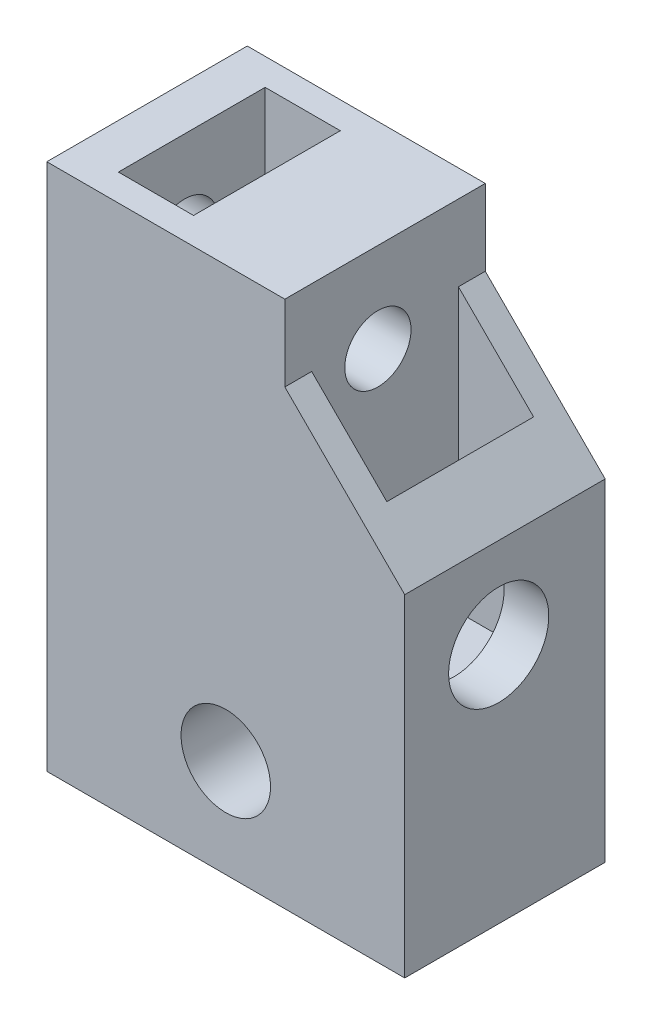
from build123d import *

# Parameters (mm, degrees)
SKETCH6_W           = 20
SKETCH6_H           = 11.2
BOSS_EXTRUDE2_DEPTH = 29.5
SKETCH7_R           = 2.5
CUT_EXTRUDE4_DEPTH  = 38.358934674
SKETCH8_R           = 2.8
CUT_EXTRUDE5_DEPTH  = 38.358934674
SKETCH9_W           = 4.2
SKETCH9_H           = 8.2
CUT_EXTRUDE6_DEPTH  = 20
SKETCH11_R          = 1.85
CUT_EXTRUDE8_DEPTH  = 38.358934674
SKETCH12_W          = 11.2
SKETCH12_H          = 11
CUT_EXTRUDE9_DEPTH  = 6.7
CHAMFER1_SIZE       = 6.75


with BuildPart() as part:
    # Sketch6 → Boss-Extrude2 (new body)
    with BuildSketch(Plane(origin=(0, 0, 0), x_dir=(1, 0, 0), z_dir=(0, 1, 0))):
        with Locations((10, 5.6)):
            Rectangle(SKETCH6_W, SKETCH6_H)
    extrude(amount=BOSS_EXTRUDE2_DEPTH)

    # Sketch7 → Cut-Extrude4 (cut, through all)
    with BuildSketch(Plane.XY):
        with Locations((10, 5.5)):
            Circle(SKETCH7_R)
    extrude(amount=-CUT_EXTRUDE4_DEPTH, mode=Mode.SUBTRACT)

    # Sketch8 → Cut-Extrude5 (cut, through all)
    with BuildSketch(Plane.ZY):
        with Locations((-5.25, 13.5)):
            Circle(SKETCH8_R)
    extrude(amount=-CUT_EXTRUDE5_DEPTH, mode=Mode.SUBTRACT)

    # Sketch9 → Cut-Extrude6 (cut)
    with BuildSketch(Plane(origin=(0, 29.5, 0), x_dir=(1, 0, 0), z_dir=(0, 1, 0))):
        with Locations((4.6, 5.6)):
            Rectangle(SKETCH9_W, SKETCH9_H)
        with Locations((15.4, 5.6)):
            Rectangle(SKETCH9_W, SKETCH9_H)
    extrude(amount=-CUT_EXTRUDE6_DEPTH, mode=Mode.SUBTRACT)

    # Sketch11 → Cut-Extrude8 (cut, through all)
    with BuildSketch(Plane(origin=(20, 0, 0), x_dir=(0, 0, -1), z_dir=(1, 0, 0))):
        with Locations((5.2, 24.5)):
            Circle(SKETCH11_R)
    extrude(amount=-CUT_EXTRUDE8_DEPTH, mode=Mode.SUBTRACT)

    # Sketch12 → Cut-Extrude9 (cut)
    with BuildSketch(Plane(origin=(20, 0, 0), x_dir=(0, 0, -1), z_dir=(1, 0, 0))):
        with Locations((5.6, 24)):
            Rectangle(SKETCH12_W, SKETCH12_H)
    extrude(amount=-CUT_EXTRUDE9_DEPTH, mode=Mode.SUBTRACT)

    # Chamfer1
    # the kernel refuses this chamfer: 6.75 mm, written as the material it adds along each edge
    with BuildSketch(Plane(origin=(13.3, 18.5, -11.2), x_dir=(-0.027495876610586268, 0.9996219169112968, 0), z_dir=(0, 0, 1))) as chamfer1_piece_1_section:
        Polygon((CHAMFER1_SIZE * 0.999621916911, -CHAMFER1_SIZE * 0.0274958766106), (-CHAMFER1_SIZE * 0.0274958766106, -CHAMFER1_SIZE * 0.999621916911), (0, 0), align=None)
    chamfer1_piece_1 = extrude(amount=1.5, mode=Mode.PRIVATE)
    chamfer1_piece_1 = split(chamfer1_piece_1, bisect_by=Plane(origin=(17.5, 21.005794574, -10.45), z_dir=(-1, 0, 0)), keep=Keep.TOP, mode=Mode.PRIVATE)
    add(chamfer1_piece_1)
    with BuildSketch(Plane(origin=(13.3, 18.5, -11.2), x_dir=(-0.027495876610586268, 0.9996219169112968, 0), z_dir=(0, 0, 1))) as chamfer1_piece_2_section:
        Polygon((CHAMFER1_SIZE * 0.999621916911, -CHAMFER1_SIZE * 0.0274958766106), (-CHAMFER1_SIZE * 0.0274958766106, -CHAMFER1_SIZE * 0.999621916911), (0, 0), align=None)
    chamfer1_piece_2 = extrude(amount=1.5, mode=Mode.PRIVATE)
    chamfer1_piece_2 = split(chamfer1_piece_2, bisect_by=Plane(origin=(17.5, 19.207926364, -10.45), z_dir=(1, 0, 0)), keep=Keep.TOP, mode=Mode.PRIVATE)
    chamfer1_piece_2 = split(chamfer1_piece_2, bisect_by=Plane(origin=(20, 19.207926364, -10.45), z_dir=(-1, 0, 0)), keep=Keep.TOP, mode=Mode.PRIVATE)
    add(chamfer1_piece_2)
    with BuildSketch(Plane(origin=(13.3, 18.5, -11.2), x_dir=(-0.027495876610586268, 0.9996219169112968, 0), z_dir=(0, 0, 1))) as chamfer1_piece_3_section:
        Polygon((CHAMFER1_SIZE * 0.999621916911, -CHAMFER1_SIZE * 0.0274958766106), (-CHAMFER1_SIZE * 0.0274958766106, -CHAMFER1_SIZE * 0.999621916911), (0, 0), align=None)
    chamfer1_piece_3 = extrude(amount=18.858860169, mode=Mode.PRIVATE)
    chamfer1_piece_3 = split(chamfer1_piece_3, bisect_by=Plane(origin=(18.428491319, 19.207926364, -9.7), z_dir=(0, 0, 1)), keep=Keep.TOP, mode=Mode.PRIVATE)
    chamfer1_piece_3 = split(chamfer1_piece_3, bisect_by=Plane(origin=(18.428491319, 19.207926364, -1.5), z_dir=(0, 0, -1)), keep=Keep.TOP, mode=Mode.PRIVATE)
    chamfer1_piece_3 = split(chamfer1_piece_3, bisect_by=Plane(origin=(17.5, 19.207926364, -5.6), z_dir=(1, 0, 0)), keep=Keep.TOP, mode=Mode.PRIVATE)
    chamfer1_piece_3 = split(chamfer1_piece_3, bisect_by=Plane(origin=(20, 19.207926364, -5.6), z_dir=(-1, 0, 0)), keep=Keep.TOP, mode=Mode.PRIVATE)
    add(chamfer1_piece_3)
    with BuildSketch(Plane(origin=(13.3, 18.5, -11.2), x_dir=(-0.027495876610586268, 0.9996219169112968, 0), z_dir=(0, 0, 1))) as chamfer1_piece_4_section:
        Polygon((CHAMFER1_SIZE * 0.999621916911, -CHAMFER1_SIZE * 0.0274958766106), (-CHAMFER1_SIZE * 0.0274958766106, -CHAMFER1_SIZE * 0.999621916911), (0, 0), align=None)
    chamfer1_piece_4 = extrude(amount=18.858860169, mode=Mode.PRIVATE)
    chamfer1_piece_4 = split(chamfer1_piece_4, bisect_by=Plane(origin=(14.991498442, 21.005794574, 0), z_dir=(0, 0, -1)), keep=Keep.TOP, mode=Mode.PRIVATE)
    chamfer1_piece_4 = split(chamfer1_piece_4, bisect_by=Plane(origin=(14.991498442, 21.005794574, -1.5), z_dir=(0, 0, 1)), keep=Keep.TOP, mode=Mode.PRIVATE)
    chamfer1_piece_4 = split(chamfer1_piece_4, bisect_by=Plane(origin=(17.5, 21.005794574, -0.75), z_dir=(-1, 0, 0)), keep=Keep.TOP, mode=Mode.PRIVATE)
    add(chamfer1_piece_4)
    with BuildSketch(Plane(origin=(13.3, 18.5, -11.2), x_dir=(-0.027495876610586268, 0.9996219169112968, 0), z_dir=(0, 0, 1))) as chamfer1_piece_5_section:
        Polygon((CHAMFER1_SIZE * 0.999621916911, -CHAMFER1_SIZE * 0.0274958766106), (-CHAMFER1_SIZE * 0.0274958766106, -CHAMFER1_SIZE * 0.999621916911), (0, 0), align=None)
    chamfer1_piece_5 = extrude(amount=18.858860169, mode=Mode.PRIVATE)
    chamfer1_piece_5 = split(chamfer1_piece_5, bisect_by=Plane(origin=(18.428491319, 19.207926364, 0), z_dir=(0, 0, -1)), keep=Keep.TOP, mode=Mode.PRIVATE)
    chamfer1_piece_5 = split(chamfer1_piece_5, bisect_by=Plane(origin=(18.428491319, 19.207926364, -1.5), z_dir=(0, 0, 1)), keep=Keep.TOP, mode=Mode.PRIVATE)
    chamfer1_piece_5 = split(chamfer1_piece_5, bisect_by=Plane(origin=(17.5, 19.207926364, -0.75), z_dir=(1, 0, 0)), keep=Keep.TOP, mode=Mode.PRIVATE)
    chamfer1_piece_5 = split(chamfer1_piece_5, bisect_by=Plane(origin=(20, 19.207926364, -0.75), z_dir=(-1, 0, 0)), keep=Keep.TOP, mode=Mode.PRIVATE)
    add(chamfer1_piece_5)


solid = part.part
